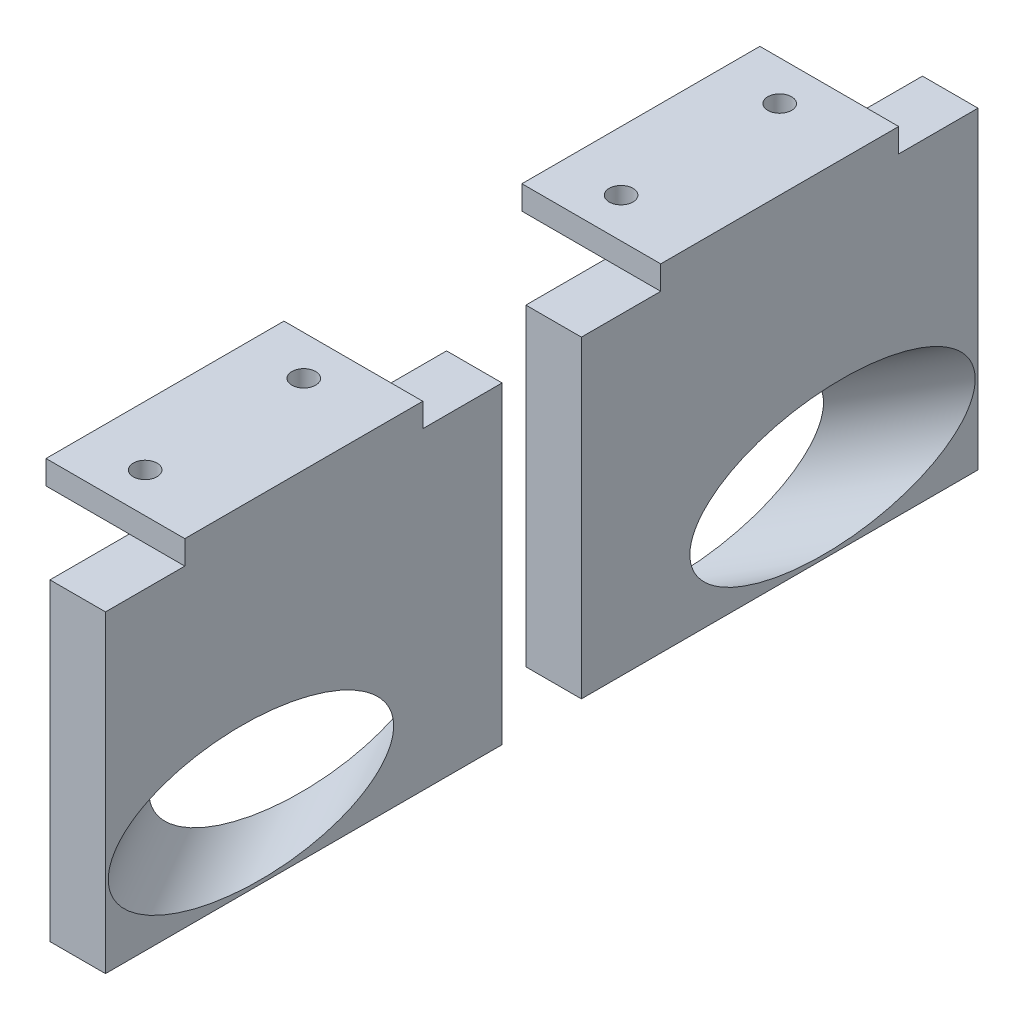
from build123d import *

# Parameters (mm, degrees)
EXTRUDE_1_DEPTH      = 5
EXTRUDE_1_DEPTH_BACK = 2
SKETCH_3_W           = 17.5
SKETCH_3_H           = 30
EXTRUDE_2_DEPTH      = 3
SKETCH_6_R           = 1.5
CUT_EXTRUDE_2_DEPTH  = 3
CUT_EXTRUDE_START    = -21.309073488
CUT_EXTRUDE_3_DEPTH  = 45.154041378


# Read off the part's stored shape, not the designer's step: 切除-拉伸3
with BuildPart() as part:
    # 草图1 → 凸台-拉伸1 (new, two sides: drawn at the far end of the back side and taken through both)
    with BuildSketch(Plane(origin=(0, 0, 0), x_dir=(0, 0, -1), z_dir=(1, 0, 0)).offset(-EXTRUDE_1_DEPTH_BACK)):
        Polygon((-20, 11), (20, 11), (25, 11), (25, -28.5), (20, -28.5), (-20, -28.5), (-25, -28.5), (-25, 11), align=None)
    extrude(amount=EXTRUDE_1_DEPTH + EXTRUDE_1_DEPTH_BACK)

    # 草图3 → 凸台-拉伸2 (add)
    with BuildSketch(Plane(origin=(0, 11, 0), x_dir=(1, 0, 0), z_dir=(0, 1, 0))):
        with Locations((-3.75, 0)):
            Rectangle(SKETCH_3_W, SKETCH_3_H)
    extrude(amount=EXTRUDE_2_DEPTH)

    # 草图6 → 切除-拉伸2 (cut)
    with BuildSketch(Plane(origin=(0, 14, 0), x_dir=(1, 0, 0), z_dir=(0, 1, 0))):
        with Locations(Location((-5, 10, 0), (0, 0, 270))):
            Circle(SKETCH_6_R)
        with Locations(Location((-5, -10, 0), (0, 0, 270))):
            Circle(SKETCH_6_R)
    extrude(amount=-CUT_EXTRUDE_2_DEPTH, mode=Mode.SUBTRACT)

    # 切除-拉伸3 outline → 切除-拉伸3 (cut)
    with BuildSketch(Plane(origin=(0, 0, 0), x_dir=(0.8660254037844362, 0, -0.5000000000000042), z_dir=(0.5000000000000042, 0, 0.8660254037844362)).offset(CUT_EXTRUDE_START)):
        with BuildLine():
            add(Edge.make_bspline(
                [(-7.991196518, -18.204047299), (-8.335854148, -33.777256489), (5.323269444, -27.184580945), (18.982393036, -20.591905402), (5.667927074, -11.611371755), (-7.646538888, -2.630838109), (-7.991196518, -18.204047299)],
                knots=[0, 0, 0, 2.094395102, 2.094395102, 4.188790205, 4.188790205, 6.283185307, 6.283185307, 6.283185307], degree=2, weights=[1, 0.5, 1, 0.5, 1, 0.5, 1]))
        make_face()
    extrude(amount=CUT_EXTRUDE_3_DEPTH, mode=Mode.SUBTRACT)


with BuildPart() as body_2:
    # 镜向1: mirrored copy
    add(part.part.mirror(Plane(origin=(0, 0, -30), x_dir=(1, 0, 0), z_dir=(0, 0, -1))))


solid = Compound([part.part, body_2.part])
